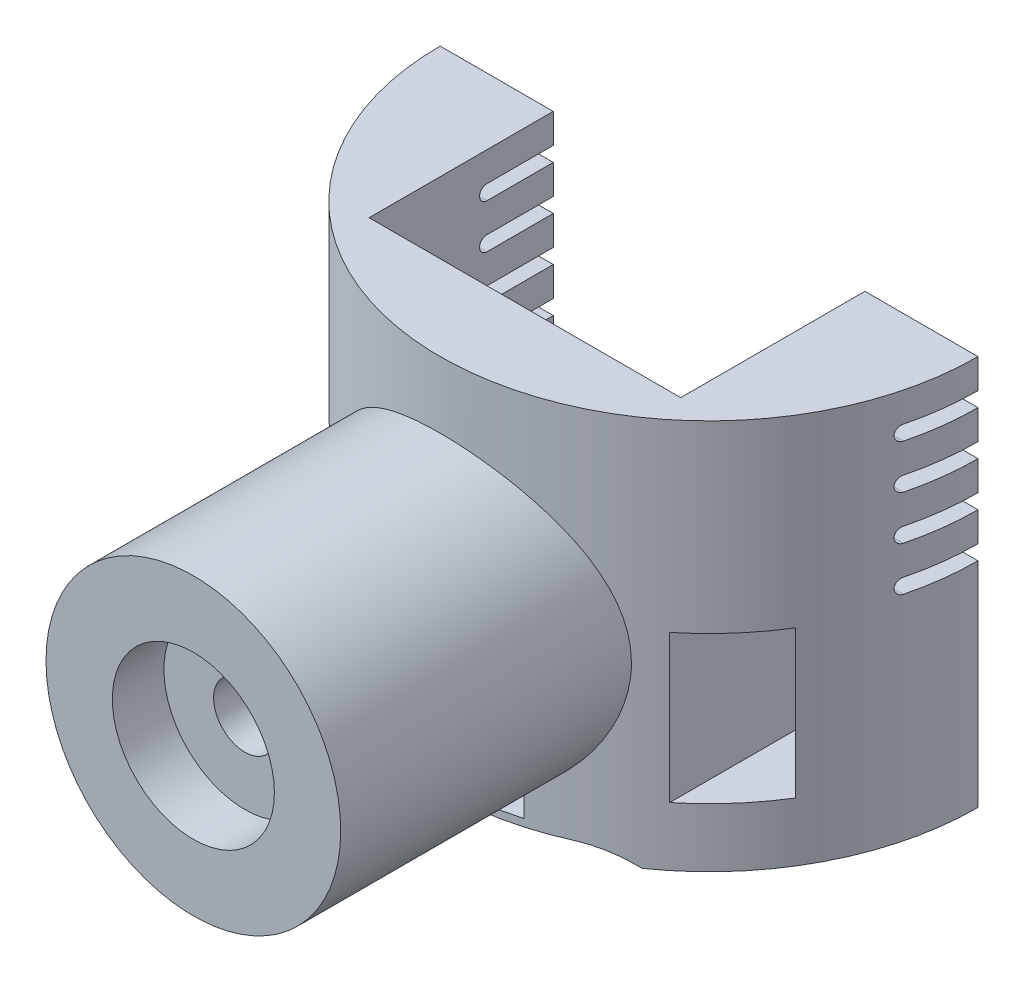
from build123d import *

# Parameters (mm, degrees)
SKETCH1_R                = 36.5
BOSS_EXTRUDE1_DEPTH      = 3
BOSS_EXTRUDE2_DEPTH      = 7
CUT_EXTRUDE1_REACH       = 54.091
SKETCH3_R                = 4.15
BOSS_EXTRUDE3_DEPTH      = 8
SKETCH5_R                = 36.5
BOSS_EXTRUDE4_DEPTH      = 5
SKETCH6_R                = 36.5
SKETCH6_W                = 42.3
SKETCH6_H                = 50
BOSS_EXTRUDE5_DEPTH      = 50
CUT_EXTRUDE3_DEPTH       = 12
BOSS_EXTRUDE7_REACH      = 136.177
BOSS_EXTRUDE7_END_RADIUS = 36.5
SKETCH11_R               = 20
SKETCH9_W                = 54.504938141
SKETCH9_H                = 78.124035864
CUT_REVOLVE1_ANGLE       = 180
SKETCH12_R               = 11
CUT_EXTRUDE4_DEPTH       = 7
CUT_EXTRUDE5_REACH       = 105.103
SKETCH13_R               = 4.25
CUT_EXTRUDE6_START       = -31
SKETCH14_R               = 11
CUT_EXTRUDE6_DEPTH       = 31
CUT_EXTRUDE7_REACH       = 106.337
CUT_EXTRUDE7_END_RADIUS  = 36.5
SKETCH16_W               = 8
SKETCH16_H               = 20
CUT_EXTRUDE8_REACH       = 106.337
SKETCH17_R               = 1.375
SKETCH18_W               = 20
SKETCH18_H               = 8.9
CUT_EXTRUDE9_DEPTH       = 15
CUT_EXTRUDE10_DEPTH      = 2.1
SKETCH20_W               = 10
SKETCH20_H               = 2
CUT_EXTRUDE11_DEPTH      = 125.73171226
FILLET1_R                = 1
SKETCH21_R               = 36.5
CUT_EXTRUDE12_DEPTH      = 20


with BuildPart() as part:
    # Sketch1 → Boss-Extrude1 (new body)
    with BuildSketch(Plane(origin=(0, 0, 0), x_dir=(1, 0, 0), z_dir=(0, 1, 0))):
        with Locations(Location((0, 0, 0), (0, 0, 270))):
            Circle(SKETCH1_R)
    extrude(amount=BOSS_EXTRUDE1_DEPTH)

    # Sketch2 → Boss-Extrude2 (add)
    with BuildSketch(Plane(origin=(0, 3, 0), x_dir=(1, 0, 0), z_dir=(0, 1, 0))):
        with BuildLine():
            Line((-11, 0), (-11, -34.803017111))
            ThreePointArc((-11, -34.803017111), (0, 36.5), (11, -34.803017111))
            Line((11, -34.803017111), (11, 0))
            ThreePointArc((11, 0), (0, 11), (-11, 0))
        make_face()
    extrude(amount=BOSS_EXTRUDE2_DEPTH)

    # Sketch3 → Cut-Extrude1 (cut, up to next)
    with BuildSketch(Plane(origin=(0, 3, 0), x_dir=(1, 0, 0), z_dir=(0, 1, 0)), mode=Mode.PRIVATE) as cut_extrude1_sk1:
        with Locations(Location((0, 0, 0), (0, 0, 270))):
            Circle(SKETCH3_R)
    cut_extrude1_tool1 = extrude(cut_extrude1_sk1.sketch, amount=-CUT_EXTRUDE1_REACH, mode=Mode.PRIVATE) & part.part
    add(cut_extrude1_tool1.solids().sort_by_distance((0, 3, 0))[0], mode=Mode.SUBTRACT)

    # Sketch4 → Boss-Extrude3 (add)
    with BuildSketch(Plane(origin=(0, 10, 0), x_dir=(1, 0, 0), z_dir=(0, 1, 0))):
        with BuildLine():
            Line((-11, -34.803017111), (-11, 0))
            ThreePointArc((-11, 0), (0, 11), (11, 0))
            Line((11, 0), (11, -34.803017111))
            ThreePointArc((11, -34.803017111), (0, 36.5), (-11, -34.803017111))
        make_face()
        with BuildLine():
            Line((-6.35, -35.943392995), (-6.35, -3.666174209))
            Line((-6.35, -3.666174209), (-6.35, 3.666174209))
            Line((-6.35, 3.666174209), (0, 7.332348419))
            Line((0, 7.332348419), (6.35, 3.666174209))
            Line((6.35, 3.666174209), (6.35, -3.666174209))
            Line((6.35, -3.666174209), (6.35, -35.943392995))
            ThreePointArc((6.35, -35.943392995), (8.693718381, -35.449531178), (11, -34.803017111))
            Line((11, -34.803017111), (11, 0))
            ThreePointArc((11, 0), (0, 11), (-11, 0))
            Line((-11, 0), (-11, -34.803017111))
            ThreePointArc((-11, -34.803017111), (-8.693718381, -35.449531178), (-6.35, -35.943392995))
        make_face()
    extrude(amount=BOSS_EXTRUDE3_DEPTH)

    # Sketch5 → Boss-Extrude4 (add)
    with BuildSketch(Plane(origin=(0, 18, 0), x_dir=(1, 0, 0), z_dir=(0, 1, 0))):
        with Locations(Location((0, 0, 0), (0, 0, 270))):
            Circle(SKETCH5_R)
    extrude(amount=BOSS_EXTRUDE4_DEPTH)

    # Sketch6 → Boss-Extrude5 (add)
    with BuildSketch(Plane(origin=(0, 23, 0), x_dir=(1, 0, 0), z_dir=(0, 1, 0))):
        with Locations(Location((0, 0, 0), (0, 0, 270))):
            Circle(SKETCH6_R)
        Rectangle(SKETCH6_W, SKETCH6_H, mode=Mode.SUBTRACT)
    extrude(amount=BOSS_EXTRUDE5_DEPTH)

    # Sketch7 → Cut-Extrude3 (cut)
    with BuildSketch(Plane(origin=(0, 0, 38.6), x_dir=(-1, 0, 0), z_dir=(0, 0, -1))):
        with BuildLine():
            Line((-14.866703783, 2), (14.866703783, 2))
            ThreePointArc((14.866703783, 2), (24.866703783, 12), (14.866703783, 22))
            Line((14.866703783, 22), (-14.866703783, 22))
            ThreePointArc((-14.866703783, 22), (-24.866703783, 12), (-14.866703783, 2))
        make_face()
    extrude(amount=CUT_EXTRUDE3_DEPTH, mode=Mode.SUBTRACT)

    # Boss-Extrude7: up to this cylinder (the profile starts outside it)
    boss_extrude7_end = Plane(origin=(0, 44, 0), z_dir=(0, -1, 0)) * Cylinder(BOSS_EXTRUDE7_END_RADIUS, 346.354, mode=Mode.PRIVATE)
    # Sketch11 → Boss-Extrude7 (add, up to the surface)
    with BuildSketch(Plane.XY.offset(70), mode=Mode.PRIVATE) as boss_extrude7_sk1:
        with Locations((0, 44)):
            Circle(SKETCH11_R)
    boss_extrude7_tool1 = extrude(boss_extrude7_sk1.sketch, amount=-BOSS_EXTRUDE7_REACH, mode=Mode.PRIVATE) - boss_extrude7_end
    add(boss_extrude7_tool1.solids().sort_by_distance((0, 44, 70))[0])

    # Sketch9 → Cut-Revolve1 (revolve, cut)
    with BuildSketch(Plane.XY):
        with Locations((27.252469071, 39.062017932)):
            Rectangle(SKETCH9_W, SKETCH9_H)
    revolve(axis=Axis((0, 0, 0), (0, 1, 0)), revolution_arc=CUT_REVOLVE1_ANGLE, mode=Mode.SUBTRACT)

    # Sketch12 → Cut-Extrude4 (cut)
    with BuildSketch(Plane.XY.offset(70)):
        with Locations((0, 44)):
            Circle(SKETCH12_R)
    extrude(amount=-CUT_EXTRUDE4_DEPTH, mode=Mode.SUBTRACT)

    # Sketch13 → Cut-Extrude5 (cut, up to next)
    with BuildSketch(Plane.XY.offset(63), mode=Mode.PRIVATE) as cut_extrude5_sk1:
        with Locations((0, 44)):
            Circle(SKETCH13_R)
    cut_extrude5_tool1 = extrude(cut_extrude5_sk1.sketch, amount=-CUT_EXTRUDE5_REACH, mode=Mode.PRIVATE) & part.part
    add(cut_extrude5_tool1.solids().sort_by_distance((0, 44, 63))[0], mode=Mode.SUBTRACT)

    # Sketch14 → Cut-Extrude6 (cut)
    with BuildSketch(Plane(origin=(0, 0, 25), x_dir=(-1, 0, 0), z_dir=(0, 0, -1)).offset(CUT_EXTRUDE6_START)):
        with Locations(Location((0, 44, 0), (0, 0, 180))):
            Circle(SKETCH14_R)
    extrude(amount=CUT_EXTRUDE6_DEPTH, mode=Mode.SUBTRACT)

    # Cut-Extrude7: up to this cylinder (the profile starts inside it)
    cut_extrude7_end = Plane(origin=(0, 38, 0), z_dir=(0, -1, 0)) * Cylinder(CUT_EXTRUDE7_END_RADIUS, 286.674, mode=Mode.PRIVATE)
    # Sketch16 → Cut-Extrude7 (cut, up to the surface)
    with BuildSketch(Plane.XY.offset(5), mode=Mode.PRIVATE) as cut_extrude7_sk1:
        with Locations((-27, 38)):
            Rectangle(SKETCH16_W, SKETCH16_H)
    cut_extrude7_tool1 = extrude(cut_extrude7_sk1.sketch, amount=CUT_EXTRUDE7_REACH, mode=Mode.PRIVATE) & cut_extrude7_end
    add(cut_extrude7_tool1.solids().sort_by_distance((-27, 38, 5))[0], mode=Mode.SUBTRACT)
    # Sketch16 → Cut-Extrude7 (cut, up to the surface)
    with BuildSketch(Plane.XY.offset(5), mode=Mode.PRIVATE) as cut_extrude7_sk2:
        with Locations((27, 38)):
            Rectangle(SKETCH16_W, SKETCH16_H)
    cut_extrude7_tool2 = extrude(cut_extrude7_sk2.sketch, amount=CUT_EXTRUDE7_REACH, mode=Mode.PRIVATE) & cut_extrude7_end
    add(cut_extrude7_tool2.solids().sort_by_distance((27, 38, 5))[0], mode=Mode.SUBTRACT)

    # Sketch17 → Cut-Extrude8 (cut, up to next)
    with BuildSketch(Plane.XY.offset(5), mode=Mode.PRIVATE) as cut_extrude8_sk1:
        with Locations((27, 42)):
            Circle(SKETCH17_R)
    cut_extrude8_tool1 = extrude(cut_extrude8_sk1.sketch, amount=-CUT_EXTRUDE8_REACH, mode=Mode.PRIVATE) & part.part
    # Sketch17 → Cut-Extrude8 (cut, up to next)
    with BuildSketch(Plane.XY.offset(5), mode=Mode.PRIVATE) as cut_extrude8_sk2:
        with Locations((27, 34)):
            Circle(SKETCH17_R)
    cut_extrude8_tool2 = extrude(cut_extrude8_sk2.sketch, amount=-CUT_EXTRUDE8_REACH, mode=Mode.PRIVATE) & part.part
    # Sketch17 → Cut-Extrude8 (cut, up to next)
    with BuildSketch(Plane.XY.offset(5), mode=Mode.PRIVATE) as cut_extrude8_sk3:
        with Locations((-27, 42)):
            Circle(SKETCH17_R)
    cut_extrude8_tool3 = extrude(cut_extrude8_sk3.sketch, amount=-CUT_EXTRUDE8_REACH, mode=Mode.PRIVATE) & part.part
    # Sketch17 → Cut-Extrude8 (cut, up to next)
    with BuildSketch(Plane.XY.offset(5), mode=Mode.PRIVATE) as cut_extrude8_sk4:
        with Locations((-27, 34)):
            Circle(SKETCH17_R)
    cut_extrude8_tool4 = extrude(cut_extrude8_sk4.sketch, amount=-CUT_EXTRUDE8_REACH, mode=Mode.PRIVATE) & part.part
    add(cut_extrude8_tool1.solids().sort_by_distance((27, 42, 5))[0], mode=Mode.SUBTRACT)
    add(cut_extrude8_tool2.solids().sort_by_distance((27, 34, 5))[0], mode=Mode.SUBTRACT)
    add(cut_extrude8_tool3.solids().sort_by_distance((-27, 42, 5))[0], mode=Mode.SUBTRACT)
    add(cut_extrude8_tool4.solids().sort_by_distance((-27, 34, 5))[0], mode=Mode.SUBTRACT)

    # Sketch18 → Cut-Extrude9 (cut)
    with BuildSketch(Plane(origin=(0, 0, 25), x_dir=(-1, 0, 0), z_dir=(0, 0, -1))):
        with Locations((0, 27.45)):
            Rectangle(SKETCH18_W, SKETCH18_H)
    extrude(amount=-CUT_EXTRUDE9_DEPTH, mode=Mode.SUBTRACT)

    # Sketch19 → Cut-Extrude10 (cut)
    with BuildSketch(Plane.XY.offset(5)):
        Polygon((-23.940043573, 42), (-25.470021787, 44.65), (-28.529978213, 44.65), (-30.059956427, 42), (-28.529978213, 39.35), (-25.470021787, 39.35), align=None)
        Polygon((-23.940043573, 34), (-25.470021787, 36.65), (-28.529978213, 36.65), (-30.059956427, 34), (-28.529978213, 31.35), (-25.470021787, 31.35), align=None)
        Polygon((30.059956427, 42), (28.529978213, 44.65), (25.470021787, 44.65), (23.940043573, 42), (25.470021787, 39.35), (28.529978213, 39.35), align=None)
        Polygon((30.059956427, 34), (28.529978213, 36.65), (25.470021787, 36.65), (23.940043573, 34), (25.470021787, 31.35), (28.529978213, 31.35), align=None)
    extrude(amount=-CUT_EXTRUDE10_DEPTH, mode=Mode.SUBTRACT)

    # Sketch20 → Cut-Extrude11 (cut, through all)
    with BuildSketch(Plane(origin=(36.5, 0, 0), x_dir=(0, 0, -1), z_dir=(1, 0, 0))):
        with Locations((-5, 68)):
            Rectangle(SKETCH20_W, SKETCH20_H)
        with Locations((-5, 62)):
            Rectangle(SKETCH20_W, SKETCH20_H)
        with Locations((-5, 56)):
            Rectangle(SKETCH20_W, SKETCH20_H)
        with Locations((-5, 50)):
            Rectangle(SKETCH20_W, SKETCH20_H)
    extrude(amount=-CUT_EXTRUDE11_DEPTH, mode=Mode.SUBTRACT)

    # Fillet1
    fillet1_edges = [part.edges().sort_by_distance(p)[0] for p in [
        (-28.126709318, 55, 10),
        (-28.126709318, 61, 10),
        (-28.126709318, 67, 10),
        (-28.126709318, 69, 10),
        (-28.126709318, 63, 10),
        (-28.126709318, 57, 10),
        (-28.126709318, 51, 10),
        (-28.126709318, 49, 10),
        (28.126709318, 51, 10),
        (28.126709318, 49, 10),
        (28.126709318, 55, 10),
        (28.126709318, 57, 10),
        (28.126709318, 63, 10),
        (28.126709318, 61, 10),
        (28.126709318, 69, 10),
        (28.126709318, 67, 10),
    ]]
    fillet(fillet1_edges, radius=FILLET1_R - 0.0001)  # a hair under: the kernel refuses the full size

    # Sketch21 → Cut-Extrude12 (cut)
    with BuildSketch(Plane.XZ):
        Circle(SKETCH21_R)
    extrude(amount=-CUT_EXTRUDE12_DEPTH, mode=Mode.SUBTRACT)


solid = part.part
